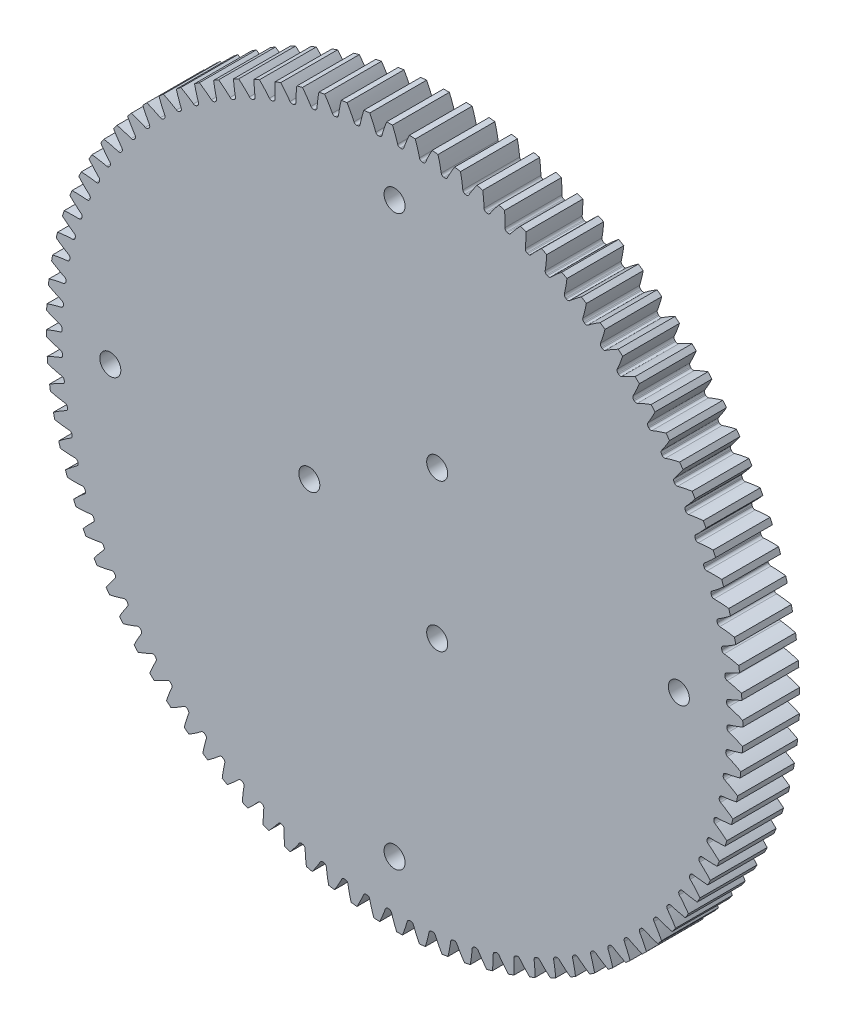
from build123d import *

# Parameters (mm, degrees)
SKETCH3_R          = 77.7875
GEARBODY_DEPTH     = 12.7
TOOTHCUT_DEPTH     = 111.738793169
CIRPATTERN1_COUNT  = 96
SKETCH4_R          = 2.349999999
CUT_EXTRUDE1_DEPTH = 111.736892249
SKETCH5_R          = 2.349999999
CUT_EXTRUDE2_DEPTH = 111.736892249


with BuildPart() as part:
    # Sketch3 → gearBody (new body)
    with BuildSketch(Plane.XY):
        Circle(SKETCH3_R)
    extrude(amount=GEARBODY_DEPTH)

    # Sketch2 → toothCut (cut, through all)
    with BuildSketch(Plane.XY):
        with BuildLine():
            ThreePointArc((74.229645105, -1.470041256), (74.231652244, -1.364931764), (74.233510549, -1.259819536))
            ThreePointArc((74.233510549, -1.259819536), (74.357469475, -0.900065574), (74.669516207, -0.682314421))
            ThreePointArc((74.669516207, -0.682314421), (83.521868489, 3.746156538), (90.39842703, 10.865737887))
            ThreePointArc((90.39842703, 10.865737887), (91.033719016, -1.673879146), (89.937868837, -14.181664866))
            ThreePointArc((89.937868837, -14.181664866), (83.327692223, -6.814096673), (74.644125506, -2.063184652))
            ThreePointArc((74.644125506, -2.063184652), (74.340294784, -1.834109074), (74.229645105, -1.470041256))
        make_face()
    toothcut = extrude(amount=TOOTHCUT_DEPTH, mode=Mode.SUBTRACT)

    # CirPattern1: toothCut ×96 about axis
    cirpattern1_axis = Axis((0, 0, 12.7), (0, 0, -1))
    for i in range(1, CIRPATTERN1_COUNT):
        add(toothcut.rotate(cirpattern1_axis, i * 360 / CIRPATTERN1_COUNT), mode=Mode.SUBTRACT)

    # Sketch4 → Cut-Extrude1 (cut, through all)
    with BuildSketch(Plane(origin=(0, 0, 0), x_dir=(-1, 0, 0), z_dir=(0, 0, -1))):
        with Locations((19.05, 0)):
            Circle(SKETCH4_R)
        with Locations((-9.525, -16.497783942)):
            Circle(SKETCH4_R)
        with Locations((-9.525, 16.497783942)):
            Circle(SKETCH4_R)
    extrude(amount=-CUT_EXTRUDE1_DEPTH, mode=Mode.SUBTRACT)

    # Sketch5 → Cut-Extrude2 (cut, through all)
    with BuildSketch(Plane(origin=(0, 0, 0), x_dir=(-1, 0, 0), z_dir=(0, 0, -1))):
        with Locations((63.5, 0)):
            Circle(SKETCH5_R)
        with Locations((0, -63.5)):
            Circle(SKETCH5_R)
        with Locations((-63.5, 0)):
            Circle(SKETCH5_R)
        with Locations((0, 63.5)):
            Circle(SKETCH5_R)
    extrude(amount=-CUT_EXTRUDE2_DEPTH, mode=Mode.SUBTRACT)


solid = part.part
